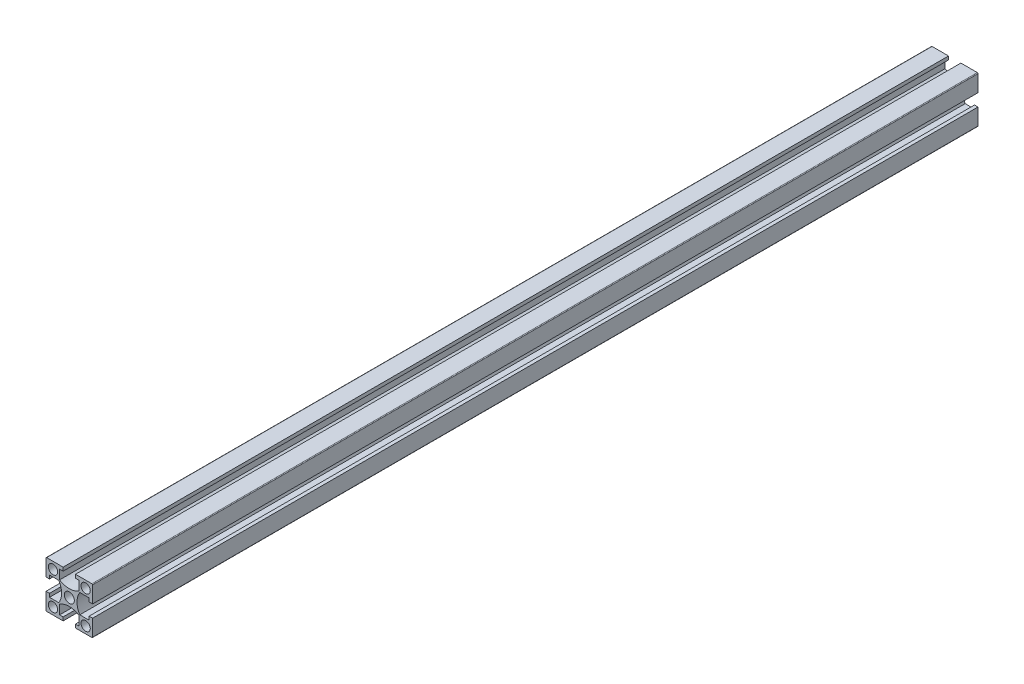
from build123d import *

# Parameters (mm, degrees)
SKETCH_1_W               = 20
SKETCH_1_H               = 20
SKETCH_1_R               = 2
SKETCH_1_R_2             = 2.15
EXTRUDE_1_DEPTH          = 380
CUT_EXTRUDE_1_REACH      = 382.263
PATTERN_CIRCULAR_1_COUNT = 4
FILLET_1_R               = 0.3
SKETCH_2_R               = 2.5
CUT_EXTRUDE_2_DEPTH      = 381.657326213


with BuildPart() as part:
    # 스케치1 → 보스-돌출1 (new body)
    with BuildSketch(Plane.XY):
        Rectangle(SKETCH_1_W, SKETCH_1_H)
        with Locations((-7, -7)):
            Circle(SKETCH_1_R, mode=Mode.SUBTRACT)
        with Locations((7, -7)):
            Circle(SKETCH_1_R, mode=Mode.SUBTRACT)
        with Locations((-7, 7)):
            Circle(SKETCH_1_R, mode=Mode.SUBTRACT)
        Circle(SKETCH_1_R_2, mode=Mode.SUBTRACT)
        with Locations((7, 7)):
            Circle(SKETCH_1_R, mode=Mode.SUBTRACT)
    extrude(amount=EXTRUDE_1_DEPTH)

    # 스케치1<3> → 컷-돌출1 (cut, up to next)
    with BuildSketch(Plane.XY, mode=Mode.PRIVATE) as cut_extrude_1_sk1:
        with BuildLine():
            Line((-8.5, 2.65), (-10, 2.65))
            Line((-10, 2.65), (-10, -2.65))
            Line((-10, -2.65), (-8.5, -2.65))
            Line((-8.5, -2.65), (-8.5, -4.15))
            Line((-8.5, -4.15), (-4.503166667, -4.15))
            ThreePointArc((-4.503166667, -4.15), (-3.3, 0), (-4.503166667, 4.15))
            Line((-4.503166667, 4.15), (-8.5, 4.15))
            Line((-8.5, 4.15), (-8.5, 2.65))
        make_face()
    cut_extrude_1_tool1 = extrude(cut_extrude_1_sk1.sketch, amount=CUT_EXTRUDE_1_REACH, mode=Mode.PRIVATE) & part.part
    cut_extrude_1 = cut_extrude_1_tool1.solids().sort_by_distance((-6.606913, 0, 0))[0]
    add(cut_extrude_1, mode=Mode.SUBTRACT)

    # 원형 패턴1: 컷-돌출1 ×4 about axis
    pattern_circular_1_axis = Axis((0, 0, 380), (0, 0, -1))
    for i in range(1, PATTERN_CIRCULAR_1_COUNT):
        add(cut_extrude_1.rotate(pattern_circular_1_axis, i * 360 / PATTERN_CIRCULAR_1_COUNT), mode=Mode.SUBTRACT)

    # 필렛1
    fillet_1_edges = [part.edges().sort_by_distance(p)[0] for p in [
        (10, -10, 190),
        (-10, -10, 190),
        (-10, 10, 190),
        (10, 10, 190),
    ]]
    fillet(fillet_1_edges, radius=FILLET_1_R)

    # 스케치2 → 컷-돌출2 (cut, through all)
    with BuildSketch(Plane.ZY.offset(10)):
        with Locations((11, 0)):
            Circle(SKETCH_2_R)
        with Locations((369, 0)):
            Circle(SKETCH_2_R)
    extrude(amount=-CUT_EXTRUDE_2_DEPTH, mode=Mode.SUBTRACT)


solid = part.part
